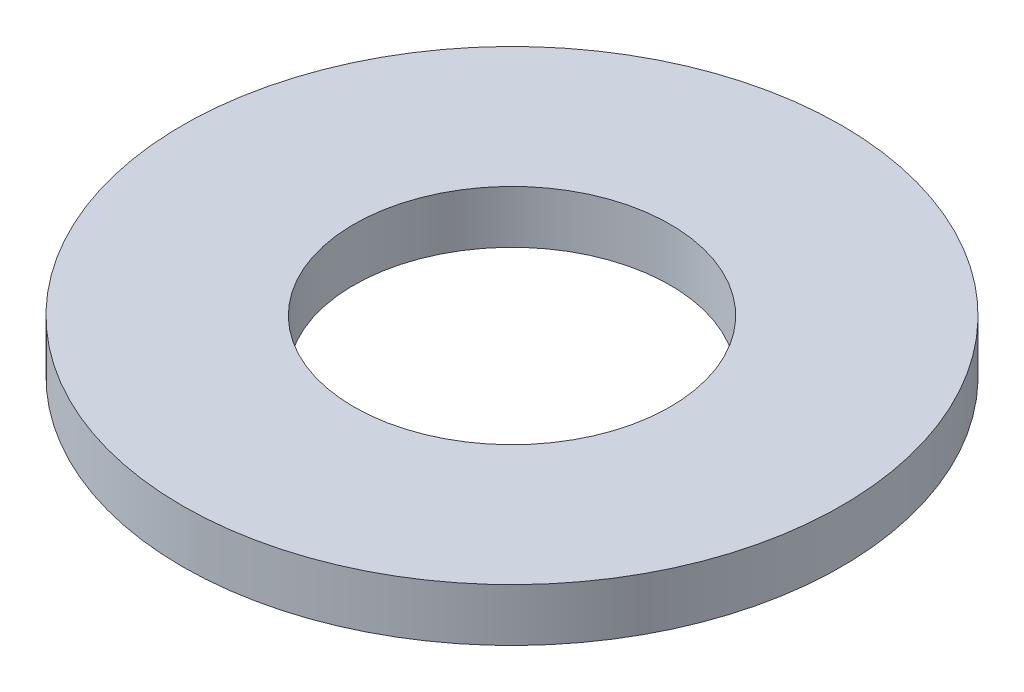
from build123d import *

# Parameters (mm, degrees)
SKETCH1_R          = 6.25
SKETCH1_R_2        = 3
BASE_EXTRUDE_DEPTH = 0.5


with BuildPart() as part:
    # Sketch1 → Base-Extrude (new, symmetric)
    with BuildSketch(Plane(origin=(0, 0, 0), x_dir=(1, 0, 0), z_dir=(0, 1, 0))):
        Circle(SKETCH1_R)
        Circle(SKETCH1_R_2, mode=Mode.SUBTRACT)
    extrude(amount=BASE_EXTRUDE_DEPTH, both=True)


solid = part.part
